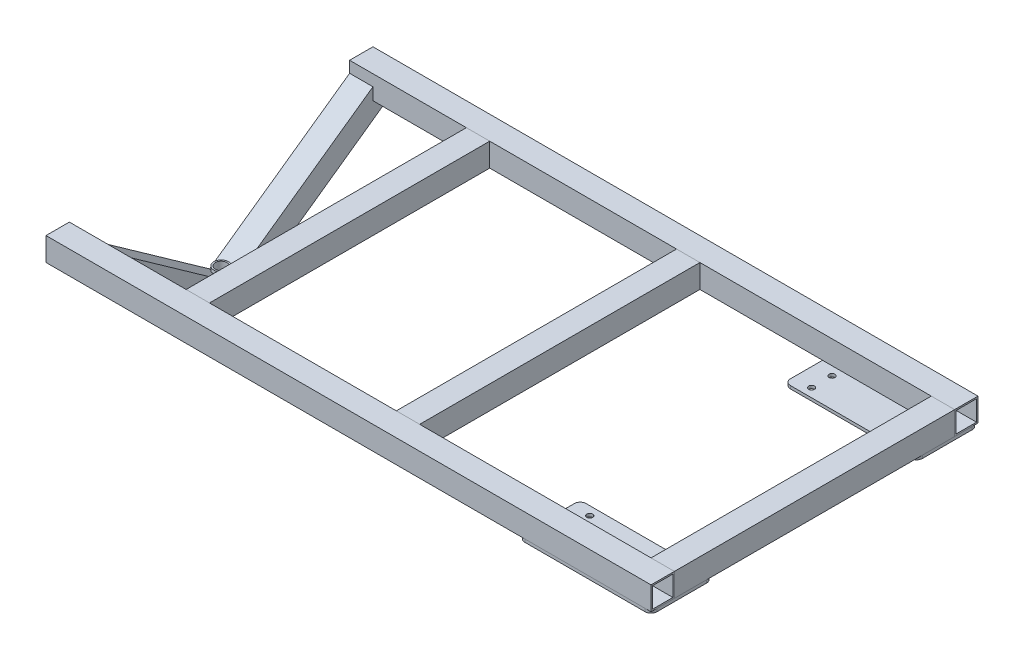
from build123d import *

# Parameters (mm, degrees)
BED_START                  = -12.7
BED_MEMBERS_OUTLINE_W      = 1.651
BED_MEMBERS_OUTLINE_H      = 304.8
BED_MEMBERS_DEPTH          = 25.4
BED_MEMBERS_2_OUTLINE_W    = 22.098
BED_MEMBERS_2_OUTLINE_H    = 304.8
BED_MEMBERS_2_DEPTH        = 1.651
BED_START_2                = 11.049
BED_MEMBERS_3_OUTLINE_W    = 22.098
BED_MEMBERS_3_OUTLINE_H    = 304.8
BED_MEMBERS_3_DEPTH        = 1.651
BED_START_3                = 152.4
BED_MEMBERS_4_OUTLINE_W    = 645.34884646
BED_MEMBERS_4_OUTLINE_H    = 1.651
BED_MEMBERS_4_DEPTH        = 25.4
BED_MEMBERS_5_OUTLINE_W    = 645.34884646
BED_MEMBERS_5_OUTLINE_H    = 22.098
BED_MEMBERS_5_DEPTH        = 1.651
BED_START_4                = 176.149
BED_MEMBERS_6_OUTLINE_W    = 645.34884646
BED_MEMBERS_6_OUTLINE_H    = 22.098
BED_MEMBERS_6_DEPTH        = 1.651
BED_START_5                = -177.8
BED_MEMBERS_7_OUTLINE_W    = 645.34884646
BED_MEMBERS_7_OUTLINE_H    = 1.651
BED_MEMBERS_7_DEPTH        = 25.4
BED_MEMBERS_8_OUTLINE_W    = 645.34884646
BED_MEMBERS_8_OUTLINE_H    = 22.098
BED_MEMBERS_8_DEPTH        = 1.651
BED_START_6                = -154.051
BED_MEMBERS_9_OUTLINE_W    = 645.34884646
BED_MEMBERS_9_OUTLINE_H    = 22.098
BED_MEMBERS_9_DEPTH        = 1.651
SKETCH1_W                  = 25.4
SKETCH1_H                  = 25.4
SKETCH1_W_2                = 22.098
SKETCH1_H_2                = 22.098
BED_CROSSMEMBERS_DEPTH     = 330.2
SKETCH1_ON_SEGMENT_2_W     = 25.4
SKETCH1_ON_SEGMENT_2_H     = 25.4
SKETCH1_ON_SEGMENT_2_W_2   = 22.098
SKETCH1_ON_SEGMENT_2_H_2   = 22.098
BED_CROSSMEMBERS_2_DEPTH   = 330.2
SKETCH132_W                = 25.4
SKETCH132_H                = 25.4
SKETCH132_W_2              = 22.098
SKETCH132_H_2              = 22.098
REAR_LEG_MEMBERS_DEPTH     = 240.663092099
SKETCH132_ON_SEGMENT_2_W   = 25.4
SKETCH132_ON_SEGMENT_2_H   = 25.4
SKETCH132_ON_SEGMENT_2_W_2 = 22.098
SKETCH132_ON_SEGMENT_2_H_2 = 22.098
REAR_LEG_MEMBERS_2_DEPTH   = 240.663092099
SKETCH133_W                = 143.69884646
SKETCH133_H                = 66.675
FRONT_LEG_PLATE_DEPTH      = 3.175
FRONT_LEG_PLATE_FILLET_R   = 6.35
SKETCH136_R                = 3.175
FRONT_LEG_BOLT_HOLES_DEPTH = 471.291138189
TRIM_EXTEND1_START         = -165.1
TRIM_EXTEND1_OUTLINE_W     = 25.4
TRIM_EXTEND1_OUTLINE_H     = 25.4
TRIM_EXTEND1_OUTLINE_W_2   = 22.098
TRIM_EXTEND1_OUTLINE_H_2   = 22.098
TRIM_EXTEND1_DEPTH         = 12.7
TRIM_EXTEND1_START_2       = 152.4
TRIM_EXTEND1_2_OUTLINE_W   = 25.4
TRIM_EXTEND1_2_OUTLINE_H   = 25.4
TRIM_EXTEND1_2_OUTLINE_W_2 = 22.098
TRIM_EXTEND1_2_OUTLINE_H_2 = 22.098
TRIM_EXTEND1_2_DEPTH       = 12.7
TRIM_EXTEND1_3_OUTLINE_W   = 25.4
TRIM_EXTEND1_3_OUTLINE_H   = 25.4
TRIM_EXTEND1_3_OUTLINE_W_2 = 22.098
TRIM_EXTEND1_3_OUTLINE_H_2 = 22.098
TRIM_EXTEND1_3_DEPTH       = 12.7
TRIM_EXTEND1_4_OUTLINE_W   = 25.4
TRIM_EXTEND1_4_OUTLINE_H   = 25.4
TRIM_EXTEND1_4_OUTLINE_W_2 = 22.098
TRIM_EXTEND1_4_OUTLINE_H_2 = 22.098
TRIM_EXTEND1_4_DEPTH       = 12.7
TRIM_EXTEND1_START_3       = -177.8
TRIM_EXTEND1_5_OUTLINE_W   = 25.4
TRIM_EXTEND1_5_OUTLINE_H   = 22.7
TRIM_EXTEND1_5_DEPTH       = 25.4
TRIM_EXTEND1_6_OUTLINE_W   = 25.4
TRIM_EXTEND1_6_OUTLINE_H   = 22.7
TRIM_EXTEND1_6_DEPTH       = 25.4
SKETCH139_R                = 7.9375
SKETCH139_R_2              = 6.2865
CASTER_PIVOT_TUBE_DEPTH    = 41.275
TRIM_EXTEND4_START         = -241.3
TRIM_EXTEND4_OUTLINE_W     = 25.4
TRIM_EXTEND4_OUTLINE_H     = 25.4
TRIM_EXTEND4_OUTLINE_W_2   = 22.098
TRIM_EXTEND4_OUTLINE_H_2   = 22.098
TRIM_EXTEND4_DEPTH         = 12.7


# Read off the part's stored shape, not the designer's step: Bed members, Trim/Extend1, Trim/Extend4
with BuildPart() as part:
    # Bed members outline → Bed members (new body)
    with BuildSketch(Plane(origin=(0, 0, 0), x_dir=(1, 0, 0), z_dir=(0, 1, 0)).offset(BED_START)):
        with Locations((415.92334646, 0)):
            Rectangle(BED_MEMBERS_OUTLINE_W, BED_MEMBERS_OUTLINE_H)
        with Locations((392.17434646, 0)):
            Rectangle(BED_MEMBERS_OUTLINE_W, BED_MEMBERS_OUTLINE_H)
    extrude(amount=BED_MEMBERS_DEPTH)

    # Bed members 2 outline → Bed members 2 (add)
    with BuildSketch(Plane(origin=(0, 0, 0), x_dir=(1, 0, 0), z_dir=(0, 1, 0)).offset(BED_START)):
        with Locations((404.04884646, 0)):
            Rectangle(BED_MEMBERS_2_OUTLINE_W, BED_MEMBERS_2_OUTLINE_H)
    extrude(amount=BED_MEMBERS_2_DEPTH)

    # Bed members 3 outline → Bed members 3 (add)
    with BuildSketch(Plane(origin=(0, 0, 0), x_dir=(1, 0, 0), z_dir=(0, 1, 0)).offset(BED_START_2)):
        with Locations((404.04884646, 0)):
            Rectangle(BED_MEMBERS_3_OUTLINE_W, BED_MEMBERS_3_OUTLINE_H)
    extrude(amount=BED_MEMBERS_3_DEPTH)


with BuildPart() as body_2:
    # Bed members 4 outline → Bed members 4 (new body)
    with BuildSketch(Plane.XY.offset(BED_START_3)):
        with Locations((94.07442323, 11.8745)):
            Rectangle(BED_MEMBERS_4_OUTLINE_W, BED_MEMBERS_4_OUTLINE_H)
        with Locations((94.07442323, -11.8745)):
            Rectangle(BED_MEMBERS_4_OUTLINE_W, BED_MEMBERS_4_OUTLINE_H)
    extrude(amount=BED_MEMBERS_4_DEPTH)

    # Bed members 5 outline → Bed members 5 (add)
    with BuildSketch(Plane.XY.offset(BED_START_3)):
        with Locations((94.07442323, 0)):
            Rectangle(BED_MEMBERS_5_OUTLINE_W, BED_MEMBERS_5_OUTLINE_H)
    extrude(amount=BED_MEMBERS_5_DEPTH)

    # Bed members 6 outline → Bed members 6 (add)
    with BuildSketch(Plane.XY.offset(BED_START_4)):
        with Locations((94.07442323, 0)):
            Rectangle(BED_MEMBERS_6_OUTLINE_W, BED_MEMBERS_6_OUTLINE_H)
    extrude(amount=BED_MEMBERS_6_DEPTH)



with BuildPart() as body_3:
    # Bed members 7 outline → Bed members 7 (new body)
    with BuildSketch(Plane.XY.offset(BED_START_5)):
        with Locations((94.07442323, 11.8745)):
            Rectangle(BED_MEMBERS_7_OUTLINE_W, BED_MEMBERS_7_OUTLINE_H)
        with Locations((94.07442323, -11.8745)):
            Rectangle(BED_MEMBERS_7_OUTLINE_W, BED_MEMBERS_7_OUTLINE_H)
    extrude(amount=BED_MEMBERS_7_DEPTH)

    # Bed members 8 outline → Bed members 8 (add)
    with BuildSketch(Plane.XY.offset(BED_START_5)):
        with Locations((94.07442323, 0)):
            Rectangle(BED_MEMBERS_8_OUTLINE_W, BED_MEMBERS_8_OUTLINE_H)
    extrude(amount=BED_MEMBERS_8_DEPTH)

    # Bed members 9 outline → Bed members 9 (add)
    with BuildSketch(Plane.XY.offset(BED_START_6)):
        with Locations((94.07442323, 0)):
            Rectangle(BED_MEMBERS_9_OUTLINE_W, BED_MEMBERS_9_OUTLINE_H)
    extrude(amount=BED_MEMBERS_9_DEPTH)


with BuildPart() as body_4:
    # Sketch1 → Bed crossmembers (new body)
    with BuildSketch(Plane(origin=(127, 0, 165.1), x_dir=(-1, 0, 0), z_dir=(0, 0, -1))):
        Rectangle(SKETCH1_W, SKETCH1_H)
        Rectangle(SKETCH1_W_2, SKETCH1_H_2, mode=Mode.SUBTRACT)
    extrude(amount=BED_CROSSMEMBERS_DEPTH)

    # Trim/Extend1 outline → Trim/Extend1 (cut)
    with BuildSketch(Plane.XY.offset(TRIM_EXTEND1_START)):
        with Locations((127, 0)):
            Rectangle(TRIM_EXTEND1_OUTLINE_W, TRIM_EXTEND1_OUTLINE_H)
        with Locations((127, 0)):
            Rectangle(TRIM_EXTEND1_OUTLINE_W_2, TRIM_EXTEND1_OUTLINE_H_2, mode=Mode.SUBTRACT)
    extrude(amount=TRIM_EXTEND1_DEPTH, mode=Mode.SUBTRACT)

    # Trim_Extend1 2 outline → Trim_Extend1 2 (cut)
    with BuildSketch(Plane.XY.offset(TRIM_EXTEND1_START_2)):
        with Locations((127, 0)):
            Rectangle(TRIM_EXTEND1_2_OUTLINE_W, TRIM_EXTEND1_2_OUTLINE_H)
        with Locations((127, 0)):
            Rectangle(TRIM_EXTEND1_2_OUTLINE_W_2, TRIM_EXTEND1_2_OUTLINE_H_2, mode=Mode.SUBTRACT)
    extrude(amount=TRIM_EXTEND1_2_DEPTH, mode=Mode.SUBTRACT)


with BuildPart() as body_5:
    # Sketch1 on segment 2 (carried to segment 2) → Bed crossmembers 2 (new body)
    with BuildSketch(Plane(origin=(-101.6, 0, 165.1), x_dir=(-1, 0, 0), z_dir=(0, 0, -1))):
        Rectangle(SKETCH1_ON_SEGMENT_2_W, SKETCH1_ON_SEGMENT_2_H)
        Rectangle(SKETCH1_ON_SEGMENT_2_W_2, SKETCH1_ON_SEGMENT_2_H_2, mode=Mode.SUBTRACT)
    extrude(amount=BED_CROSSMEMBERS_2_DEPTH)

    # Trim_Extend1 3 outline → Trim_Extend1 3 (cut)
    with BuildSketch(Plane.XY.offset(TRIM_EXTEND1_START)):
        with Locations((-101.6, 0)):
            Rectangle(TRIM_EXTEND1_3_OUTLINE_W, TRIM_EXTEND1_3_OUTLINE_H)
        with Locations((-101.6, 0)):
            Rectangle(TRIM_EXTEND1_3_OUTLINE_W_2, TRIM_EXTEND1_3_OUTLINE_H_2, mode=Mode.SUBTRACT)
    extrude(amount=TRIM_EXTEND1_3_DEPTH, mode=Mode.SUBTRACT)

    # Trim_Extend1 4 outline → Trim_Extend1 4 (cut)
    with BuildSketch(Plane.XY.offset(TRIM_EXTEND1_START_2)):
        with Locations((-101.6, 0)):
            Rectangle(TRIM_EXTEND1_4_OUTLINE_W, TRIM_EXTEND1_4_OUTLINE_H)
        with Locations((-101.6, 0)):
            Rectangle(TRIM_EXTEND1_4_OUTLINE_W_2, TRIM_EXTEND1_4_OUTLINE_H_2, mode=Mode.SUBTRACT)
    extrude(amount=TRIM_EXTEND1_4_DEPTH, mode=Mode.SUBTRACT)


with BuildPart() as body_6:
    # Sketch132 → Rear leg members (new body)
    with BuildSketch(Plane(origin=(-228.6, -2.338672494, 170.45609829), x_dir=(0, 0.8158525595063999, -0.5782599771269463), z_dir=(0, -0.5782599771269463, -0.8158525595063999))):
        Rectangle(SKETCH132_W, SKETCH132_H)
        Rectangle(SKETCH132_W_2, SKETCH132_H_2, mode=Mode.SUBTRACT)
    extrude(amount=REAR_LEG_MEMBERS_DEPTH)

    # Rear leg members mitre 1
    split(bisect_by=Plane(origin=(-228.6, -138.721084, 0), x_dir=(0, -1, 0), z_dir=(0, 0, 1)), keep=Keep.TOP)

    # Trim_Extend1 6 outline → Trim_Extend1 6 (cut)
    with BuildSketch(Plane.XY.offset(TRIM_EXTEND1_START_2)):
        with Locations((-228.6, -1.35)):
            Rectangle(TRIM_EXTEND1_6_OUTLINE_W, TRIM_EXTEND1_6_OUTLINE_H)
    extrude(amount=TRIM_EXTEND1_6_DEPTH, mode=Mode.SUBTRACT)


with BuildPart() as body_7:
    # Sketch132 on segment 2 (carried to segment 2) → Rear leg members 2 (new body)
    with BuildSketch(Plane(origin=(-228.6, -141.504506626, 25.889501377), x_dir=(0, 0.81585256, 0.578259977), z_dir=(0, 0.578259977, -0.81585256))):
        Rectangle(SKETCH132_ON_SEGMENT_2_W, SKETCH132_ON_SEGMENT_2_H)
        Rectangle(SKETCH132_ON_SEGMENT_2_W_2, SKETCH132_ON_SEGMENT_2_H_2, mode=Mode.SUBTRACT)
    extrude(amount=REAR_LEG_MEMBERS_2_DEPTH)

    # Rear leg members 2 mitre 1
    split(bisect_by=Plane(origin=(-228.6, -138.721084, 0), x_dir=(0, 1, 0), z_dir=(0, 0, -1)), keep=Keep.TOP)

    # Trim_Extend1 5 outline → Trim_Extend1 5 (cut)
    with BuildSketch(Plane.XY.offset(TRIM_EXTEND1_START_3)):
        with Locations((-228.6, -1.35)):
            Rectangle(TRIM_EXTEND1_5_OUTLINE_W, TRIM_EXTEND1_5_OUTLINE_H)
    extrude(amount=TRIM_EXTEND1_5_DEPTH, mode=Mode.SUBTRACT)


with BuildPart() as body_8:
    # Sketch133 → Front leg plate (new body)
    with BuildSketch(Plane.XZ.offset(12.7)):
        with Locations((344.89942323, 144.4625)):
            Rectangle(SKETCH133_W, SKETCH133_H)
    extrude(amount=FRONT_LEG_PLATE_DEPTH)

    # Front leg plate fillet
    front_leg_plate_fillet_edges = [body_8.edges().sort_by_distance(p)[0] for p in [
        (273.05, -14.2875, 111.125),
        (273.05, -14.2875, 177.8),
        (416.74884646, -14.2875, 177.8),
        (416.74884646, -14.2875, 111.125),
    ]]
    fillet(front_leg_plate_fillet_edges, radius=FRONT_LEG_PLATE_FILLET_R)

    # Sketch136 → Front leg bolt holes (cut, through all)
    with BuildSketch(Plane(origin=(0, -12.7, 0), x_dir=(1, 0, 0), z_dir=(0, 1, 0))):
        with Locations(Location((292.92384646, -120.65, 0), (0, 0, 180))):
            Circle(SKETCH136_R)
        with Locations(Location((292.92384646, -142.875, 0), (0, 0, 180))):
            Circle(SKETCH136_R)
        with Locations(Location((378.64884646, -142.875, 0), (0, 0, 180))):
            Circle(SKETCH136_R)
        with Locations(Location((378.64884646, -120.65, 0), (0, 0, 180))):
            Circle(SKETCH136_R)
    extrude(amount=-FRONT_LEG_BOLT_HOLES_DEPTH, mode=Mode.SUBTRACT)


with BuildPart() as body_9:
    # Front leg plate mirror: mirrored copy
    add(body_8.part.mirror(Plane.XY))


with BuildPart() as body_10:
    # Sketch139 → Caster pivot tube (new body)
    with BuildSketch(Plane(origin=(-228.6, -98.425, 0), x_dir=(0, 0, -1), z_dir=(0, -1, 0))):
        Circle(SKETCH139_R)
        Circle(SKETCH139_R_2, mode=Mode.SUBTRACT)
    extrude(amount=CASTER_PIVOT_TUBE_DEPTH)


with BuildPart() as body_2_1:
    add(body_2.part)

    add(body_3.part)  # Trim/Extend4 merges body 3
    # Trim/Extend4 outline → Trim/Extend4 (add)
    # profile 1 of 2: a face of its own
    with BuildSketch(Plane.YZ.offset(TRIM_EXTEND4_START)):
        with Locations((0, 165.1)):
            Rectangle(TRIM_EXTEND4_OUTLINE_W, TRIM_EXTEND4_OUTLINE_H)
        with Locations((0, 165.1)):
            Rectangle(TRIM_EXTEND4_OUTLINE_W_2, TRIM_EXTEND4_OUTLINE_H_2, mode=Mode.SUBTRACT)
    # profile 2 of 2: a face of its own
    with BuildSketch(Plane.YZ.offset(TRIM_EXTEND4_START)):
        with Locations((0, -165.1)):
            Rectangle(TRIM_EXTEND4_OUTLINE_W, TRIM_EXTEND4_OUTLINE_H)
        with Locations((0, -165.1)):
            Rectangle(TRIM_EXTEND4_OUTLINE_W_2, TRIM_EXTEND4_OUTLINE_H_2, mode=Mode.SUBTRACT)
    extrude(amount=TRIM_EXTEND4_DEPTH)


with BuildPart() as body_6_1:
    add(body_6.part)

    # Trim/Extend3: cut back where it meets the other member's skin (coped)
    split(bisect_by=body_10.part.faces().sort_by_distance((-228.6, -119.0625, 7.9375))[0], keep=Keep.TOP)


with BuildPart() as body_7_1:
    add(body_7.part)

    # Trim/Extend3: cut back where it meets the other member's skin (coped)
    split(bisect_by=body_10.part.faces().sort_by_distance((-228.6, -119.0625, 7.9375))[0], keep=Keep.TOP)


solid = Compound([part.part, body_4.part, body_5.part, body_8.part, body_9.part, body_10.part, body_2_1.part, body_6_1.part, body_7_1.part])
